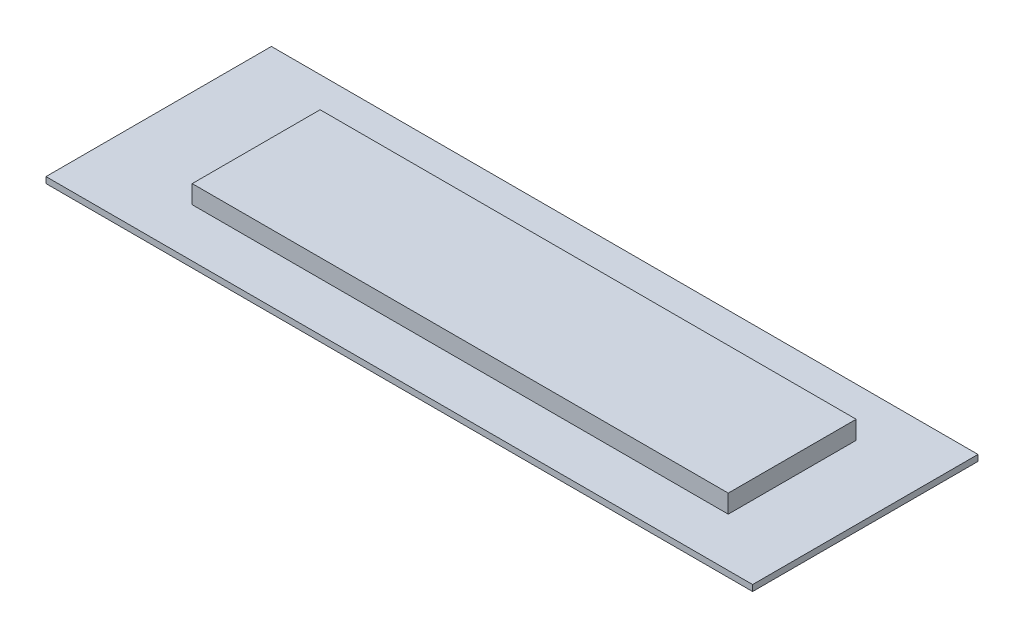
from build123d import *

# Parameters (mm, degrees)
SKETCH1_W           = 116
SKETCH1_H           = 37
BOSS_EXTRUDE1_DEPTH = 1
SKETCH2_W           = 88
SKETCH2_H           = 21
BOSS_EXTRUDE2_DEPTH = 3


with BuildPart() as part:
    # Sketch1 → Boss-Extrude1 (new body)
    with BuildSketch(Plane(origin=(0, 0, 0), x_dir=(1, 0, 0), z_dir=(0, 1, 0))):
        Rectangle(SKETCH1_W, SKETCH1_H)
    extrude(amount=BOSS_EXTRUDE1_DEPTH)

    # Sketch2 → Boss-Extrude2 (add)
    with BuildSketch(Plane(origin=(0, 1, 0), x_dir=(1, 0, 0), z_dir=(0, 1, 0))):
        with Locations((2, 0)):
            Rectangle(SKETCH2_W, SKETCH2_H)
    extrude(amount=BOSS_EXTRUDE2_DEPTH)


solid = part.part
